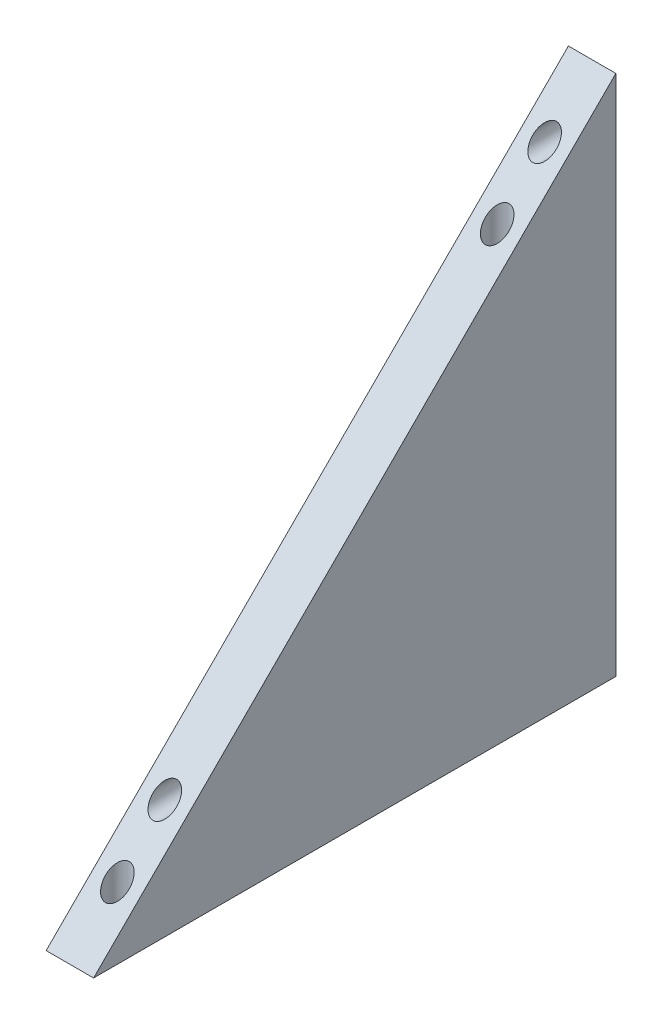
from build123d import *

# Parameters (mm, degrees)
BOSS_EXTRUDE1_DEPTH = 8
SKETCH2_R           = 2
CUT_EXTRUDE1_DEPTH  = 125.707658145
SKETCH3_R           = 2
CUT_EXTRUDE2_DEPTH  = 125.707658145


with BuildPart() as part:
    # Sketch1 → Boss-Extrude1 (new body)
    with BuildSketch(Plane(origin=(0, 0, 0), x_dir=(0, 0, -1), z_dir=(1, 0, 0))):
        Polygon((-88, 0), (0, 0), (0, 88), align=None)
    extrude(amount=BOSS_EXTRUDE1_DEPTH)

    # Sketch2 → Cut-Extrude1 (cut, through all)
    with BuildSketch(Plane(origin=(0, 0, 0), x_dir=(1, 0, 0), z_dir=(0, 1, 0))):
        with Locations((4, -16)):
            Circle(SKETCH2_R)
        with Locations((4, -80)):
            Circle(SKETCH2_R)
    extrude(amount=CUT_EXTRUDE1_DEPTH, mode=Mode.SUBTRACT)

    # Sketch3 → Cut-Extrude2 (cut, through all)
    with BuildSketch(Plane.XY):
        with Locations((4, 16)):
            Circle(SKETCH3_R)
        with Locations((4, 80)):
            Circle(SKETCH3_R)
    extrude(amount=CUT_EXTRUDE2_DEPTH, mode=Mode.SUBTRACT)


solid = part.part
